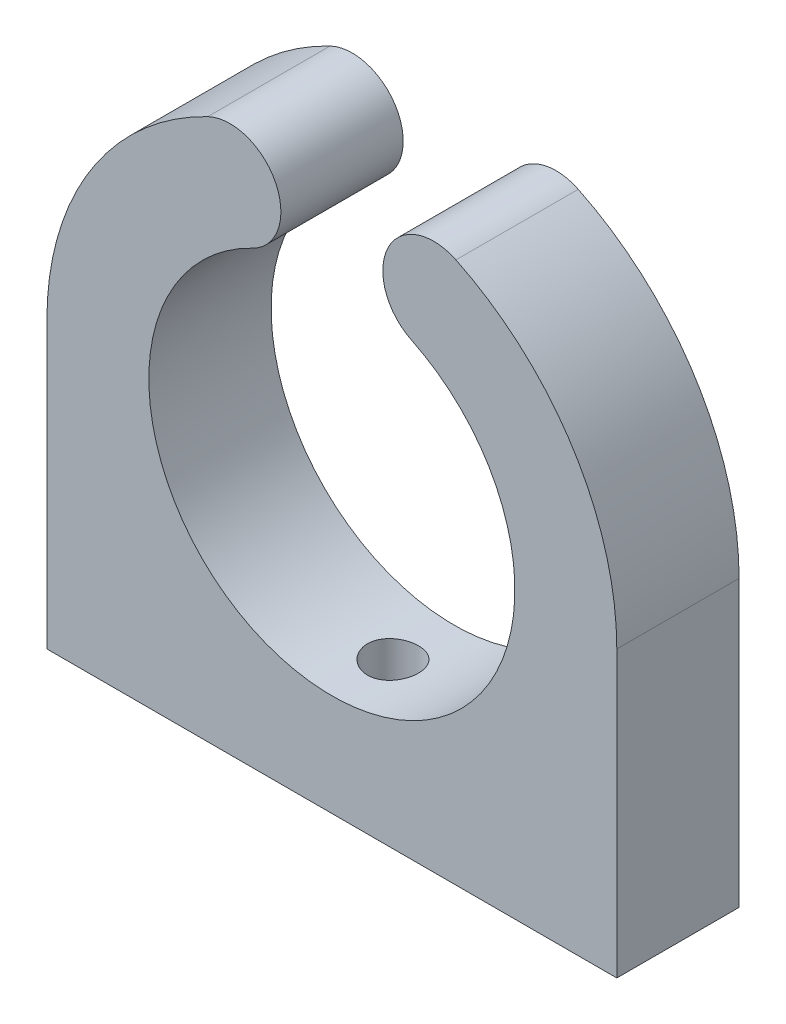
from build123d import *

# Parameters (mm, degrees)
BOSS_EXTRUDE1_DEPTH             = 3
M3X0_5_TAPPED_HOLE1_D           = 2.5
M3X0_5_TAPPED_HOLE1_DEPTH       = 21.312444934
M3X0_5_TAPPED_HOLE1_CSINK_D     = 3.05
M3X0_5_TAPPED_HOLE1_CSINK_ANGLE = 90
M3X0_5_TAPPED_HOLE1_TIP         = 0.751075774


with BuildPart() as part:
    # Sketch1 → Boss-Extrude1 (new, symmetric)
    with BuildSketch(Plane.XY):
        with BuildLine():
            Line((-13.98, 0), (-13.98, -13.98))
            Line((-13.98, -13.98), (13.98, -13.98))
            Line((13.98, -13.98), (13.98, 0))
            ThreePointArc((13.98, 0), (11.844039122, 7.426919771), (6.088850174, 12.584367428))
            ThreePointArc((6.088850174, 12.584367428), (2.74957664, 11.422794242), (3.911149826, 8.083520708))
            ThreePointArc((3.911149826, 8.083520708), (4.770653758, -7.607973628), (-8.98, 0))
            ThreePointArc((-8.98, 0), (-7.607973628, 4.770653758), (-3.911149826, 8.083520708))
            ThreePointArc((-3.911149826, 8.083520708), (-2.74957664, 11.422794242), (-6.088850174, 12.584367428))
            ThreePointArc((-6.088850174, 12.584367428), (-11.844039122, 7.426919771), (-13.98, 0))
        make_face()
    extrude(amount=BOSS_EXTRUDE1_DEPTH, both=True)

    # M3x0.5 Tapped Hole1
    with Locations(Plane(origin=(0, -13.98, 0), x_dir=(0, 0, -1), z_dir=(0, -1, 0))):
        with Locations((0, 0)):
            CounterSinkHole(M3X0_5_TAPPED_HOLE1_D / 2, M3X0_5_TAPPED_HOLE1_CSINK_D / 2, depth=M3X0_5_TAPPED_HOLE1_DEPTH, counter_sink_angle=M3X0_5_TAPPED_HOLE1_CSINK_ANGLE)
            with Locations((0, 0, -(M3X0_5_TAPPED_HOLE1_DEPTH + M3X0_5_TAPPED_HOLE1_TIP / 2))):  # 118° drill point
                Cone(0, M3X0_5_TAPPED_HOLE1_D / 2, M3X0_5_TAPPED_HOLE1_TIP, mode=Mode.SUBTRACT)


solid = part.part
